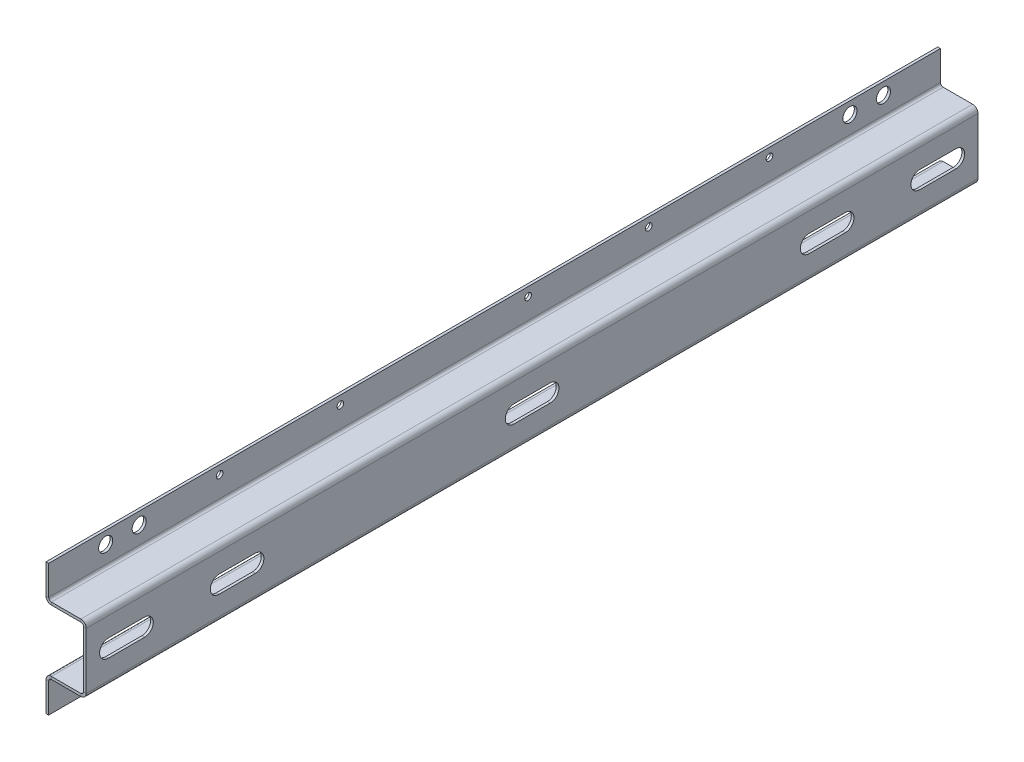
from build123d import *

# Parameters (mm, degrees)
SM_BASE_FLANGE_1_DEPTH = 332.5
SKETCH_6_R             = 5.25
SKETCH_6_R_2           = 2.5
CUT_EXTRUDE_1_DEPTH    = 10
CUT_EXTRUDE_2_DEPTH    = 10


# Sheet-metal steps are written as plain solids
with BuildPart() as part:
    # Sketch 1 → Базовая кромка1 (new, symmetric)
    with BuildSketch(Plane.XY):
        with BuildLine():
            Line((-28, 49), (-28, 27))
            ThreePointArc((-28, 27), (-26.828427125, 24.171572875), (-24, 23))
            Line((-24, 23), (-2, 23))
            ThreePointArc((-2, 23), (-0.585786438, 22.414213562), (0, 21))
            Line((0, 21), (0, -21))
            ThreePointArc((0, -21), (-0.585786438, -22.414213562), (-2, -23))
            Line((-2, -23), (-24, -23))
            ThreePointArc((-24, -23), (-26.828427125, -24.171572875), (-28, -27))
            Line((-28, -27), (-28, -49))
            Line((-28, -49), (-26, -49))
            Line((-26, -49), (-26, -27))
            ThreePointArc((-26, -27), (-25.414213562, -25.585786438), (-24, -25))
            Line((-24, -25), (-2, -25))
            ThreePointArc((-2, -25), (0.828427125, -23.828427125), (2, -21))
            Line((2, -21), (2, 21))
            ThreePointArc((2, 21), (0.828427125, 23.828427125), (-2, 25))
            Line((-2, 25), (-24, 25))
            ThreePointArc((-24, 25), (-25.414213562, 25.585786438), (-26, 27))
            Line((-26, 27), (-26, 49))
            Line((-26, 49), (-28, 49))
        make_face()
    extrude(amount=SM_BASE_FLANGE_1_DEPTH, both=True)

    # Эскиз6 → Вырез-Вытянуть1 (cut)
    with BuildSketch(Plane(origin=(-26, 0, 0), x_dir=(0, 0, -1), z_dir=(1, 0, 0))):
        with Locations(Location((290, 40, 0), (0, 0, 90))):
            Circle(SKETCH_6_R)
        with Locations(Location((265, 40, 0), (0, 0, 90))):
            Circle(SKETCH_6_R)
        with Locations(Location((205, 42.5, 0), (0, 0, 90))):
            Circle(SKETCH_6_R_2)
        with Locations(Location((115, 42.5, 0), (0, 0, 90))):
            Circle(SKETCH_6_R_2)
        with Locations(Location((25, 42.5, 0), (0, 0, 90))):
            Circle(SKETCH_6_R_2)
        with Locations(Location((-115, 42.5, 0), (0, 0, 270))):
            Circle(SKETCH_6_R_2)
        with Locations(Location((-205, 42.5, 0), (0, 0, 270))):
            Circle(SKETCH_6_R_2)
        with Locations(Location((-265, 40, 0), (0, 0, 270))):
            Circle(SKETCH_6_R)
        with Locations(Location((-290, 40, 0), (0, 0, 270))):
            Circle(SKETCH_6_R)
    cut_extrude_1 = extrude(amount=-CUT_EXTRUDE_1_DEPTH, mode=Mode.SUBTRACT)

    # Зеркальное отражение1: Вырез-Вытянуть1 across plane
    add(cut_extrude_1.mirror(Plane.ZX), mode=Mode.SUBTRACT)

    # Эскиз7 → Вырез-Вытянуть2 (cut)
    with BuildSketch(Plane(origin=(2, 0, 0), x_dir=(0, 0, -1), z_dir=(1, 0, 0))):
        with BuildLine():
            Line((-316, 6.5), (-289, 6.5))
            ThreePointArc((-289, 6.5), (-282.5, 0), (-289, -6.5))
            Line((-289, -6.5), (-316, -6.5))
            ThreePointArc((-316, -6.5), (-322.5, 0), (-316, 6.5))
        make_face()
        with BuildLine():
            Line((-233.5, 6.5), (-206.5, 6.5))
            ThreePointArc((-206.5, 6.5), (-200, 0), (-206.5, -6.5))
            Line((-206.5, -6.5), (-233.5, -6.5))
            ThreePointArc((-233.5, -6.5), (-240, 0), (-233.5, 6.5))
        make_face()
        with BuildLine():
            Line((-13.5, 6.5), (13.5, 6.5))
            ThreePointArc((13.5, 6.5), (20, 0), (13.5, -6.5))
            Line((13.5, -6.5), (-13.5, -6.5))
            ThreePointArc((-13.5, -6.5), (-20, 0), (-13.5, 6.5))
        make_face()
        with BuildLine():
            Line((316, 6.5), (289, 6.5))
            ThreePointArc((289, 6.5), (282.5, 0), (289, -6.5))
            Line((289, -6.5), (316, -6.5))
            ThreePointArc((316, -6.5), (322.5, 0), (316, 6.5))
        make_face()
        with BuildLine():
            Line((233.5, 6.5), (206.5, 6.5))
            ThreePointArc((206.5, 6.5), (200, 0), (206.5, -6.5))
            Line((206.5, -6.5), (233.5, -6.5))
            ThreePointArc((233.5, -6.5), (240, 0), (233.5, 6.5))
        make_face()
    extrude(amount=-CUT_EXTRUDE_2_DEPTH, mode=Mode.SUBTRACT)


solid = part.part
